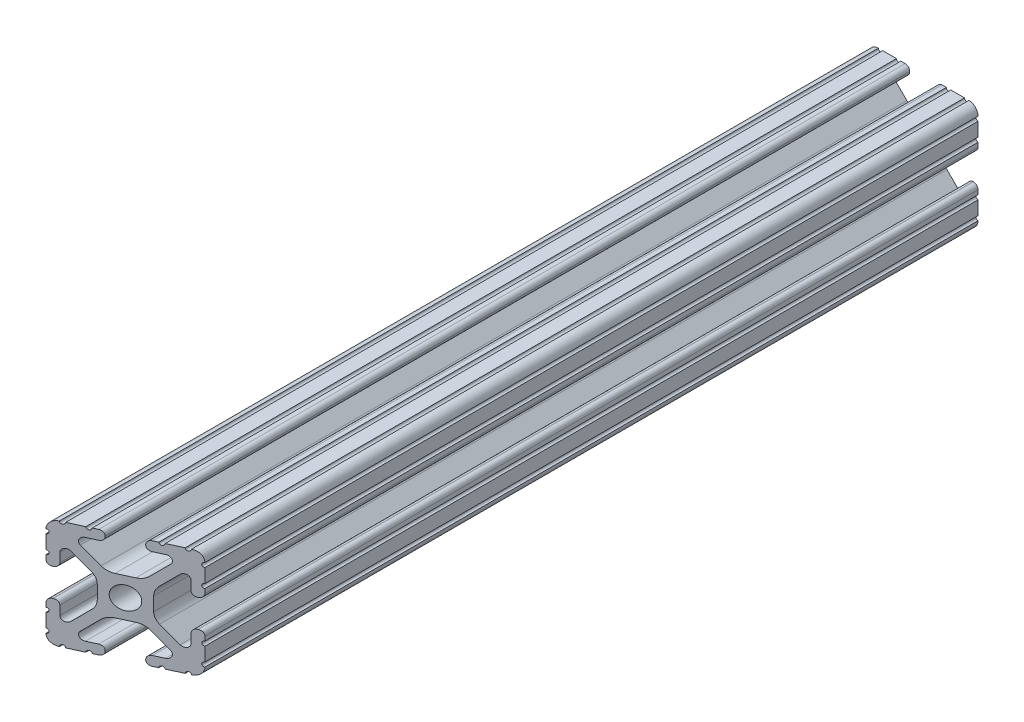
from build123d import *

# Parameters (mm, degrees)
SKETCH1_R           = 2.6035
BOSS_EXTRUDE1_DEPTH = 144.78
CUT_EXTRUDE1_DEPTH  = 148.538803032


with BuildPart() as part:
    # Sketch1 → Boss-Extrude1 (new, symmetric)
    with BuildSketch(Plane.XY):
        with BuildLine():
            Line((-7.179650497, -8.645192506), (-3.952270251, -5.423690499))
            ThreePointArc((-3.952270251, -5.423690499), (-2.922936451, -4.736929036), (-1.709253557, -4.4958))
            Line((-1.709253557, -4.4958), (1.709253557, -4.4958))
            ThreePointArc((1.709253557, -4.4958), (2.922936451, -4.736929036), (3.952270251, -5.423690499))
            Line((3.952270251, -5.423690499), (7.179650497, -8.645192506))
            ThreePointArc((7.179650497, -8.645192506), (7.41473083, -9.822813117), (6.416408329, -10.4902))
            Line((6.416408329, -10.4902), (4.287512407, -10.4902))
            ThreePointArc((4.287512407, -10.4902), (3.54574862, -10.79744862), (3.2385, -11.539212407))
            Line((3.2385, -11.539212407), (3.2385, -11.650987593))
            ThreePointArc((3.2385, -11.650987593), (3.54574862, -12.39275138), (4.287512407, -12.7))
            Line((4.287512407, -12.7), (5.317126718, -12.7))
            ThreePointArc((5.317126718, -12.7), (5.825126718, -12.192), (6.333126718, -12.7))
            Line((6.333126718, -12.7), (9.550443118, -12.7))
            ThreePointArc((9.550443118, -12.7), (10.058366869, -12.192000006), (10.566443095, -12.699847501))
            ThreePointArc((10.566443095, -12.699847501), (12.082537762, -12.08250727), (12.699846982, -10.566399977))
            ThreePointArc((12.699846982, -10.566399977), (12.192000006, -10.058323491), (12.7, -9.5504))
            Line((12.7, -9.5504), (12.7, -6.3330836))
            ThreePointArc((12.7, -6.3330836), (12.192, -5.8250836), (12.7, -5.3170836))
            Line((12.7, -5.3170836), (12.7, -4.287469289))
            ThreePointArc((12.7, -4.287469289), (12.39275138, -3.545705502), (11.650987593, -3.238456882))
            Line((11.650987593, -3.238456882), (11.539212407, -3.238456882))
            ThreePointArc((11.539212407, -3.238456882), (10.79744862, -3.545705502), (10.4902, -4.287469289))
            Line((10.4902, -4.287469289), (10.4902, -6.402089023))
            ThreePointArc((10.4902, -6.402089023), (9.856505071, -7.351067942), (8.737131347, -7.129408934))
            Line((8.737131347, -7.129408934), (5.441005833, -3.840816462))
            ThreePointArc((5.441005833, -3.840816462), (4.750877967, -2.809883091), (4.5085, -1.593185507))
            Line((4.5085, -1.593185507), (4.5085, 1.593185507))
            ThreePointArc((4.5085, 1.593185507), (4.750877967, 2.809883091), (5.441005833, 3.840816462))
            Line((5.441005833, 3.840816462), (8.737131347, 7.129408934))
            ThreePointArc((8.737131347, 7.129408934), (9.856505071, 7.351067942), (10.4902, 6.402089023))
            Line((10.4902, 6.402089023), (10.4902, 4.287469289))
            ThreePointArc((10.4902, 4.287469289), (10.79744862, 3.545705502), (11.539212407, 3.238456882))
            Line((11.539212407, 3.238456882), (11.650987593, 3.238456882))
            ThreePointArc((11.650987593, 3.238456882), (12.39275138, 3.545705502), (12.7, 4.287469289))
            Line((12.7, 4.287469289), (12.7, 5.3170836))
            ThreePointArc((12.7, 5.3170836), (12.192, 5.8250836), (12.7, 6.3330836))
            Line((12.7, 6.3330836), (12.7, 9.5504))
            ThreePointArc((12.7, 9.5504), (12.192000006, 10.058323491), (12.699846982, 10.566399977))
            ThreePointArc((12.699846982, 10.566399977), (12.082537762, 12.08250727), (10.566443095, 12.699847501))
            ThreePointArc((10.566443095, 12.699847501), (10.058366869, 12.192000006), (9.550443118, 12.7))
            Line((9.550443118, 12.7), (6.333126718, 12.7))
            ThreePointArc((6.333126718, 12.7), (5.825126718, 12.192), (5.317126718, 12.7))
            Line((5.317126718, 12.7), (4.287512407, 12.7))
            ThreePointArc((4.287512407, 12.7), (3.54574862, 12.39275138), (3.2385, 11.650987593))
            Line((3.2385, 11.650987593), (3.2385, 11.539212407))
            ThreePointArc((3.2385, 11.539212407), (3.54574862, 10.79744862), (4.287512407, 10.4902))
            Line((4.287512407, 10.4902), (6.476788598, 10.4902))
            ThreePointArc((6.476788598, 10.4902), (7.432222385, 9.85140422), (7.207036008, 8.724370562))
            Line((7.207036008, 8.724370562), (3.898272566, 5.423169045))
            ThreePointArc((3.898272566, 5.423169045), (2.869120213, 4.736787962), (1.655778399, 4.4958))
            Line((1.655778399, 4.4958), (-1.655778399, 4.4958))
            ThreePointArc((-1.655778399, 4.4958), (-2.869120213, 4.736787962), (-3.898272566, 5.423169045))
            Line((-3.898272566, 5.423169045), (-7.207036008, 8.724370562))
            ThreePointArc((-7.207036008, 8.724370562), (-7.432222385, 9.85140422), (-6.476788598, 10.4902))
            Line((-6.476788598, 10.4902), (-4.287512407, 10.4902))
            ThreePointArc((-4.287512407, 10.4902), (-3.54574862, 10.79744862), (-3.2385, 11.539212407))
            Line((-3.2385, 11.539212407), (-3.2385, 11.650987593))
            ThreePointArc((-3.2385, 11.650987593), (-3.54574862, 12.39275138), (-4.287512407, 12.7))
            Line((-4.287512407, 12.7), (-5.317126718, 12.7))
            ThreePointArc((-5.317126718, 12.7), (-5.825126718, 12.192), (-6.333126718, 12.7))
            Line((-6.333126718, 12.7), (-9.550443118, 12.7))
            ThreePointArc((-9.550443118, 12.7), (-10.058366869, 12.192000006), (-10.566443095, 12.699847501))
            ThreePointArc((-10.566443095, 12.699847501), (-12.082537762, 12.08250727), (-12.699846982, 10.566399977))
            ThreePointArc((-12.699846982, 10.566399977), (-12.192000006, 10.058323491), (-12.7, 9.5504))
            Line((-12.7, 9.5504), (-12.7, 6.3330836))
            ThreePointArc((-12.7, 6.3330836), (-12.192, 5.8250836), (-12.7, 5.3170836))
            Line((-12.7, 5.3170836), (-12.7, 4.287469289))
            ThreePointArc((-12.7, 4.287469289), (-12.39275138, 3.545705502), (-11.650987593, 3.238456882))
            Line((-11.650987593, 3.238456882), (-11.539212407, 3.238456882))
            ThreePointArc((-11.539212407, 3.238456882), (-10.79744862, 3.545705502), (-10.4902, 4.287469289))
            Line((-10.4902, 4.287469289), (-10.4902, 6.402089023))
            ThreePointArc((-10.4902, 6.402089023), (-9.856505071, 7.351067942), (-8.737131347, 7.129408934))
            Line((-8.737131347, 7.129408934), (-5.441005833, 3.840816462))
            ThreePointArc((-5.441005833, 3.840816462), (-4.750877967, 2.809883091), (-4.5085, 1.593185507))
            Line((-4.5085, 1.593185507), (-4.5085, -1.593185507))
            ThreePointArc((-4.5085, -1.593185507), (-4.750877967, -2.809883091), (-5.441005833, -3.840816462))
            Line((-5.441005833, -3.840816462), (-8.737131347, -7.129408934))
            ThreePointArc((-8.737131347, -7.129408934), (-9.856505071, -7.351067942), (-10.4902, -6.402089023))
            Line((-10.4902, -6.402089023), (-10.4902, -4.287469289))
            ThreePointArc((-10.4902, -4.287469289), (-10.79744862, -3.545705502), (-11.539212407, -3.238456882))
            Line((-11.539212407, -3.238456882), (-11.650987593, -3.238456882))
            ThreePointArc((-11.650987593, -3.238456882), (-12.39275138, -3.545705502), (-12.7, -4.287469289))
            Line((-12.7, -4.287469289), (-12.7, -5.3170836))
            ThreePointArc((-12.7, -5.3170836), (-12.192, -5.8250836), (-12.7, -6.3330836))
            Line((-12.7, -6.3330836), (-12.7, -9.5504))
            ThreePointArc((-12.7, -9.5504), (-12.192000006, -10.058323491), (-12.699846982, -10.566399977))
            ThreePointArc((-12.699846982, -10.566399977), (-12.082537762, -12.08250727), (-10.566443095, -12.699847501))
            ThreePointArc((-10.566443095, -12.699847501), (-10.058366869, -12.192000006), (-9.550443118, -12.7))
            Line((-9.550443118, -12.7), (-6.333126718, -12.7))
            ThreePointArc((-6.333126718, -12.7), (-5.825126718, -12.192), (-5.317126718, -12.7))
            Line((-5.317126718, -12.7), (-4.287512407, -12.7))
            ThreePointArc((-4.287512407, -12.7), (-3.54574862, -12.39275138), (-3.2385, -11.650987593))
            Line((-3.2385, -11.650987593), (-3.2385, -11.539212407))
            ThreePointArc((-3.2385, -11.539212407), (-3.54574862, -10.79744862), (-4.287512407, -10.4902))
            Line((-4.287512407, -10.4902), (-6.416408329, -10.4902))
            ThreePointArc((-6.416408329, -10.4902), (-7.41473083, -9.822813117), (-7.179650497, -8.645192506))
        make_face()
        Circle(SKETCH1_R, mode=Mode.SUBTRACT)
    extrude(amount=BOSS_EXTRUDE1_DEPTH, both=True)

    # Sketch2 → Cut-Extrude1 (cut, through all)
    with BuildSketch(Plane(origin=(0, 12.7, 0), x_dir=(1, 0, 0), z_dir=(0, 1, 0))):
        Polygon((12.7, -144.78), (-12.7, -144.78), (-12.7, -47.4328244), (12.7, -35.726737444), align=None)
    extrude(amount=-CUT_EXTRUDE1_DEPTH, mode=Mode.SUBTRACT)


solid = part.part
